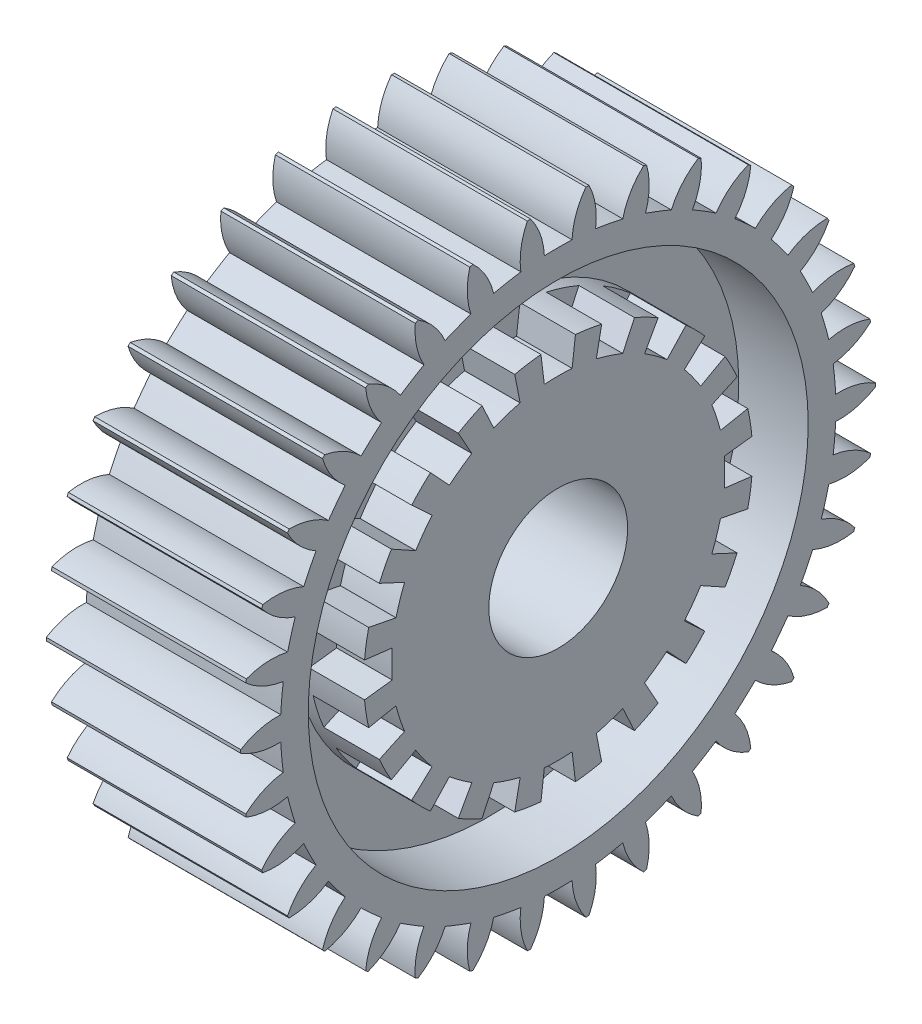
from build123d import *

# Parameters (mm, degrees)
SKETCH1_R                = 114.3
BOSS_EXTRUDE1_DEPTH      = 35
SKETCH2_R                = 25
CUT_EXTRUDE1_DEPTH       = 177.150447062
SKETCH3_R                = 90
SKETCH3_R_2              = 70
CUT_EXTRUDE2_DEPTH       = 25
CUT_EXTRUDE5_DEPTH       = 177.150447062
FILLET2_R                = 150
CIRPATTERN2_START        = -35
CIRPATTERN2_DEPTH        = 70
CUT_EXTRUDE6_DEPTH       = 20
FILLET3_R                = 80
CIRPATTERN3_COUNT        = 20
FILLET3_OF_CIRPATTERN3_R = 80


with BuildPart() as part:
    # Sketch1 → Boss-Extrude1 (new, symmetric)
    with BuildSketch(Plane(origin=(0, 0, 0), x_dir=(0, 0, -1), z_dir=(1, 0, 0))):
        Circle(SKETCH1_R)
    extrude(amount=BOSS_EXTRUDE1_DEPTH, both=True)

    # Sketch2 → Cut-Extrude1 (cut, through all)
    with BuildSketch(Plane(origin=(35, 0, 0), x_dir=(0, 0, -1), z_dir=(1, 0, 0))):
        Circle(SKETCH2_R)
    extrude(amount=-CUT_EXTRUDE1_DEPTH, mode=Mode.SUBTRACT)

    # Sketch3 → Cut-Extrude2 (cut)
    with BuildSketch(Plane(origin=(35, 0, 0), x_dir=(0, 0, -1), z_dir=(1, 0, 0))):
        Circle(SKETCH3_R)
        Circle(SKETCH3_R_2, mode=Mode.SUBTRACT)
    extrude(amount=-CUT_EXTRUDE2_DEPTH, mode=Mode.SUBTRACT)

    # Sketch4 → Cut-Extrude5 (cut, through all)
    with BuildSketch(Plane(origin=(35, 0, 0), x_dir=(0, 0, -1), z_dir=(1, 0, 0))):
        with BuildLine():
            Line((0, 100.093383634), (-4.985, 99.875671587))
            ThreePointArc((-4.985, 99.875671587), (-6.426481355, 107.245609371), (-9.975, 113.863907253))
            Line((-9.975, 113.863907253), (0, 138.618178177))
            Line((0, 138.618178177), (9.975, 113.863907253))
            ThreePointArc((9.975, 113.863907253), (6.426481355, 107.245609371), (4.985, 99.875671587))
            Line((4.985, 99.875671587), (0, 100.093383634))
        make_face()
    extrude(amount=-CUT_EXTRUDE5_DEPTH, mode=Mode.SUBTRACT)

    # Fillet2
    # the kernel refuses this fillet: 150 mm, written as the material it takes off along each edge
    with BuildSketch(Plane(origin=(47.474379628, 100.093383634, 0), x_dir=(0, -0.043631838376275996, -0.9990476778812443), z_dir=(-1, 0, 0))) as fillet2_piece_1:
        with BuildLine():
            CenterArc((6.550659731, 149.991878335), FILLET2_R, 265.594805512, 3.808960835)
            Line((-4.970753497, 0.435009429), (0, 0))
            Line((0, 0), (4.989751851, 0))
        make_face()
    extrude(amount=94.948759255, mode=Mode.SUBTRACT)

    # CirPattern2: read off the stored shape, not the designer's step
    # CirPattern2 outline → CirPattern2 (cut)
    with BuildSketch(Plane.YZ.offset(CIRPATTERN2_START)):
        with BuildLine():
            ThreePointArc((97.259107137, -23.252227398), (104.238686221, -26.023387308), (110.092256415, -30.727594724))
            ThreePointArc((110.092256415, -30.727594724), (112.353825294, -21.002569886), (113.758059295, -11.117281385))
            ThreePointArc((113.758059295, -11.117281385), (106.600411921, -13.389270712), (99.091089829, -13.451985594))
            ThreePointArc((99.091089829, -13.451985594), (98.256544653, -18.367331424), (97.259107137, -23.252227398))
        make_face()
        with BuildLine():
            ThreePointArc((91.330500442, -40.727628079), (97.682039631, -44.734098017), (102.571545825, -50.433798063))
            ThreePointArc((102.571545825, -50.433798063), (106.581575821, -41.289922445), (109.778317065, -31.830977086))
            ThreePointArc((109.778317065, -31.830977086), (102.325065296, -32.749067224), (94.932079854, -31.430879952))
            ThreePointArc((94.932079854, -31.430879952), (93.208551969, -36.109185404), (91.330500442, -40.727628079))
        make_face()
        with BuildLine():
            ThreePointArc((82.291743094, -56.816098234), (87.79894834, -61.921442671), (91.557884263, -68.422538898))
            ThreePointArc((91.557884263, -68.422538898), (97.179818614, -60.171196217), (102.060205912, -51.46070704))
            ThreePointArc((102.060205912, -51.46070704), (94.565161299, -50.99363353), (87.540271758, -48.339433391))
            ThreePointArc((87.540271758, -48.339433391), (84.98645384, -52.621384385), (82.291743094, -56.816098234))
        make_face()
        with BuildLine():
            ThreePointArc((70.450639133, -70.969764307), (74.925969165, -77.000126861), (77.426328764, -84.081232234))
            ThreePointArc((77.426328764, -84.081232234), (84.468719238, -77.003412069), (90.866556855, -69.338004336))
            ThreePointArc((90.866556855, -69.338004336), (83.584954151, -67.501672806), (77.1673847, -63.601845402))
            ThreePointArc((77.1673847, -63.601845402), (73.870243954, -67.341625233), (70.450639133, -70.969764307))
        make_face()
        with BuildLine():
            ThreePointArc((56.210423152, -82.706640175), (59.501475974, -89.456664083), (60.658112502, -96.876640051))
            ThreePointArc((60.658112502, -96.876640051), (68.881138938, -91.213369078), (76.578556186, -84.854079056))
            ThreePointArc((76.578556186, -84.854079056), (69.758361638, -81.711023574), (64.166654908, -76.69837285))
            ThreePointArc((64.166654908, -76.69837285), (60.238471509, -79.7686278), (56.210423152, -82.706640175))
        make_face()
        with BuildLine():
            ThreePointArc((40.056028628, -91.627040608), (42.050731384, -98.8668619), (41.82425697, -106.373030082))
            ThreePointArc((41.82425697, -106.373030082), (50.947894065, -102.317164202), (59.682764633, -97.480549884))
            ThreePointArc((59.682764633, -97.480549884), (53.556231787, -93.137803435), (48.980806643, -87.183029201))
            ThreePointArc((48.980806643, -87.183029201), (44.555350164, -89.47920542), (40.056028628, -91.627040608))
        make_face()
        with BuildLine():
            ThreePointArc((22.537574091, -97.427192067), (23.16799957, -104.910267314), (21.56612653, -112.247014154))
            ThreePointArc((21.56612653, -112.247014154), (31.279679765, -109.936671014), (40.754548111, -106.787437502))
            ThreePointArc((40.754548111, -106.787437502), (35.530308695, -101.392887107), (32.126975753, -94.698772056))
            ThreePointArc((32.126975753, -94.698772056), (27.354949808, -96.142676018), (22.537574091, -97.427192067))
        make_face()
        with BuildLine():
            ThreePointArc((4.251629499, -99.909577352), (3.496309318, -107.3810794), (0.573587516, -114.298560784))
            ThreePointArc((0.573587516, -114.298560784), (10.546273487, -113.81241635), (20.438484333, -112.457807013))
            ThreePointArc((20.438484333, -112.457807013), (16.294443555, -106.195157617), (14.179099236, -98.989661808))
            ThreePointArc((14.179099236, -98.989661808), (9.223009444, -99.532123094), (4.251629499, -99.909577352))
        make_face()
        with BuildLine():
            ThreePointArc((-14.179099236, -98.989661808), (-16.294443555, -106.195157617), (-20.438484333, -112.457807013))
            ThreePointArc((-20.438484333, -112.457807013), (-10.546273487, -113.81241635), (-0.573587516, -114.298560784))
            ThreePointArc((-0.573587516, -114.298560784), (-3.496309318, -107.3810794), (-4.251629499, -99.909577352))
            ThreePointArc((-4.251629499, -99.909577352), (-9.223009444, -99.532123094), (-14.179099236, -98.989661808))
        make_face()
        with BuildLine():
            ThreePointArc((-32.126975753, -94.698772056), (-35.530308695, -101.392887107), (-40.754548111, -106.787437502))
            ThreePointArc((-40.754548111, -106.787437502), (-31.279679765, -109.936671014), (-21.56612653, -112.247014154))
            ThreePointArc((-21.56612653, -112.247014154), (-23.16799957, -104.910267314), (-22.537574091, -97.427192067))
            ThreePointArc((-22.537574091, -97.427192067), (-27.354949808, -96.142676018), (-32.126975753, -94.698772056))
        make_face()
        with BuildLine():
            ThreePointArc((-48.980806643, -87.183029201), (-53.556231787, -93.137803435), (-59.682764633, -97.480549885))
            ThreePointArc((-59.682764633, -97.480549885), (-50.947894065, -102.317164202), (-41.82425697, -106.373030082))
            ThreePointArc((-41.82425697, -106.373030082), (-42.050731384, -98.8668619), (-40.056028628, -91.627040608))
            ThreePointArc((-40.056028628, -91.627040608), (-44.555350164, -89.47920542), (-48.980806643, -87.183029201))
        make_face()
        with BuildLine():
            ThreePointArc((-64.166654908, -76.69837285), (-69.758361638, -81.711023574), (-76.578556186, -84.854079056))
            ThreePointArc((-76.578556186, -84.854079056), (-68.881138938, -91.213369078), (-60.658112502, -96.876640051))
            ThreePointArc((-60.658112502, -96.876640051), (-59.501475974, -89.456664083), (-56.210423152, -82.706640175))
            ThreePointArc((-56.210423152, -82.706640175), (-60.238471509, -79.7686278), (-64.166654908, -76.69837285))
        make_face()
        with BuildLine():
            ThreePointArc((-77.1673847, -63.601845402), (-83.584954151, -67.501672806), (-90.866556855, -69.338004336))
            ThreePointArc((-90.866556855, -69.338004336), (-84.468719238, -77.003412069), (-77.426328764, -84.081232234))
            ThreePointArc((-77.426328764, -84.081232234), (-74.925969165, -77.000126861), (-70.450639133, -70.969764307))
            ThreePointArc((-70.450639133, -70.969764307), (-73.870243954, -67.341625233), (-77.1673847, -63.601845402))
        make_face()
        with BuildLine():
            ThreePointArc((-87.540271758, -48.339433391), (-94.565161299, -50.99363353), (-102.060205913, -51.46070704))
            ThreePointArc((-102.060205913, -51.46070704), (-97.179818614, -60.171196217), (-91.557884263, -68.422538898))
            ThreePointArc((-91.557884263, -68.422538898), (-87.79894834, -61.921442671), (-82.291743094, -56.816098234))
            ThreePointArc((-82.291743094, -56.816098234), (-84.98645384, -52.621384385), (-87.540271758, -48.339433391))
        make_face()
        with BuildLine():
            ThreePointArc((-94.932079854, -31.430879952), (-102.325065296, -32.749067224), (-109.778317065, -31.830977086))
            ThreePointArc((-109.778317065, -31.830977086), (-106.581575821, -41.289922445), (-102.571545825, -50.433798063))
            ThreePointArc((-102.571545825, -50.433798063), (-97.682039631, -44.734098017), (-91.330500442, -40.727628079))
            ThreePointArc((-91.330500442, -40.727628079), (-93.208551969, -36.109185404), (-94.932079854, -31.430879952))
        make_face()
        with BuildLine():
            ThreePointArc((-99.091089829, -13.451985594), (-106.600411921, -13.389270712), (-113.758059295, -11.117281385))
            ThreePointArc((-113.758059295, -11.117281385), (-112.353825294, -21.002569886), (-110.092256415, -30.727594724))
            ThreePointArc((-110.092256415, -30.727594724), (-104.238686221, -26.023387308), (-97.259107137, -23.252227398))
            ThreePointArc((-97.259107137, -23.252227398), (-98.256544653, -18.367331424), (-99.091089829, -13.451985594))
        make_face()
        with BuildLine():
            ThreePointArc((-99.875671587, 4.985), (-107.245609371, 6.426481355), (-113.863907253, 9.975))
            ThreePointArc((-113.863907253, 9.975), (-114.3, 0), (-113.863907253, -9.975))
            ThreePointArc((-113.863907253, -9.975), (-107.245609371, -6.426481355), (-99.875671587, -4.985))
            ThreePointArc((-99.875671587, -4.985), (-99.958528555, 0), (-99.875671587, 4.985))
        make_face()
        with BuildLine():
            ThreePointArc((-97.259107137, 23.252227398), (-104.238686221, 26.023387308), (-110.092256415, 30.727594724))
            ThreePointArc((-110.092256415, 30.727594724), (-112.353825294, 21.002569886), (-113.758059295, 11.117281385))
            ThreePointArc((-113.758059295, 11.117281385), (-106.600411921, 13.389270712), (-99.091089829, 13.451985594))
            ThreePointArc((-99.091089829, 13.451985594), (-98.256544653, 18.367331424), (-97.259107137, 23.252227398))
        make_face()
        with BuildLine():
            ThreePointArc((-91.330500442, 40.727628079), (-97.682039631, 44.734098017), (-102.571545825, 50.433798063))
            ThreePointArc((-102.571545825, 50.433798063), (-106.581575821, 41.289922445), (-109.778317066, 31.830977086))
            ThreePointArc((-109.778317066, 31.830977086), (-102.325065296, 32.749067224), (-94.932079854, 31.430879952))
            ThreePointArc((-94.932079854, 31.430879952), (-93.208551969, 36.109185404), (-91.330500442, 40.727628079))
        make_face()
        with BuildLine():
            ThreePointArc((-82.291743094, 56.816098234), (-87.79894834, 61.921442671), (-91.557884263, 68.422538898))
            ThreePointArc((-91.557884263, 68.422538898), (-97.179818614, 60.171196217), (-102.060205913, 51.46070704))
            ThreePointArc((-102.060205913, 51.46070704), (-94.565161299, 50.99363353), (-87.540271758, 48.339433391))
            ThreePointArc((-87.540271758, 48.339433391), (-84.98645384, 52.621384385), (-82.291743094, 56.816098234))
        make_face()
        with BuildLine():
            ThreePointArc((-70.450639133, 70.969764307), (-74.925969165, 77.000126861), (-77.426328764, 84.081232234))
            ThreePointArc((-77.426328764, 84.081232234), (-84.468719238, 77.003412069), (-90.866556855, 69.338004336))
            ThreePointArc((-90.866556855, 69.338004336), (-83.584954151, 67.501672806), (-77.1673847, 63.601845402))
            ThreePointArc((-77.1673847, 63.601845402), (-73.870243954, 67.341625233), (-70.450639133, 70.969764307))
        make_face()
        with BuildLine():
            ThreePointArc((-56.210423152, 82.706640175), (-59.501475974, 89.456664083), (-60.658112502, 96.876640051))
            ThreePointArc((-60.658112502, 96.876640051), (-68.881138938, 91.213369078), (-76.578556186, 84.854079056))
            ThreePointArc((-76.578556186, 84.854079056), (-69.758361638, 81.711023574), (-64.166654908, 76.69837285))
            ThreePointArc((-64.166654908, 76.69837285), (-60.238471509, 79.7686278), (-56.210423152, 82.706640175))
        make_face()
        with BuildLine():
            ThreePointArc((-40.056028628, 91.627040608), (-42.050731384, 98.8668619), (-41.82425697, 106.373030082))
            ThreePointArc((-41.82425697, 106.373030082), (-50.947894065, 102.317164202), (-59.682764633, 97.480549884))
            ThreePointArc((-59.682764633, 97.480549884), (-53.556231787, 93.137803435), (-48.980806643, 87.183029201))
            ThreePointArc((-48.980806643, 87.183029201), (-44.555350164, 89.47920542), (-40.056028628, 91.627040608))
        make_face()
        with BuildLine():
            ThreePointArc((-22.537574091, 97.427192067), (-23.16799957, 104.910267314), (-21.56612653, 112.247014154))
            ThreePointArc((-21.56612653, 112.247014154), (-31.279679765, 109.936671014), (-40.754548111, 106.787437502))
            ThreePointArc((-40.754548111, 106.787437502), (-35.530308695, 101.392887107), (-32.126975753, 94.698772056))
            ThreePointArc((-32.126975753, 94.698772056), (-27.354949808, 96.142676018), (-22.537574091, 97.427192067))
        make_face()
        with BuildLine():
            ThreePointArc((-4.251629499, 99.909577352), (-3.496309318, 107.3810794), (-0.573587516, 114.298560784))
            ThreePointArc((-0.573587516, 114.298560784), (-10.546273487, 113.81241635), (-20.438484333, 112.457807013))
            ThreePointArc((-20.438484333, 112.457807013), (-16.294443555, 106.195157617), (-14.179099236, 98.989661808))
            ThreePointArc((-14.179099236, 98.989661808), (-9.223009444, 99.532123094), (-4.251629499, 99.909577352))
        make_face()
        with BuildLine():
            ThreePointArc((14.179099236, 98.989661808), (16.294443555, 106.195157617), (20.438484333, 112.457807013))
            ThreePointArc((20.438484333, 112.457807013), (10.546273487, 113.81241635), (0.573587516, 114.298560784))
            ThreePointArc((0.573587516, 114.298560784), (3.496309318, 107.3810794), (4.251629499, 99.909577352))
            ThreePointArc((4.251629499, 99.909577352), (9.223009444, 99.532123094), (14.179099236, 98.989661808))
        make_face()
        with BuildLine():
            ThreePointArc((32.126975753, 94.698772056), (35.530308695, 101.392887107), (40.754548111, 106.787437502))
            ThreePointArc((40.754548111, 106.787437502), (31.279679765, 109.936671014), (21.56612653, 112.247014154))
            ThreePointArc((21.56612653, 112.247014154), (23.16799957, 104.910267314), (22.537574091, 97.427192067))
            ThreePointArc((22.537574091, 97.427192067), (27.354949808, 96.142676018), (32.126975753, 94.698772056))
        make_face()
        with BuildLine():
            ThreePointArc((48.980806643, 87.183029201), (53.556231787, 93.137803435), (59.682764633, 97.480549885))
            ThreePointArc((59.682764633, 97.480549885), (50.947894065, 102.317164202), (41.82425697, 106.373030082))
            ThreePointArc((41.82425697, 106.373030082), (42.050731384, 98.8668619), (40.056028628, 91.627040608))
            ThreePointArc((40.056028628, 91.627040608), (44.555350164, 89.47920542), (48.980806643, 87.183029201))
        make_face()
        with BuildLine():
            ThreePointArc((64.166654908, 76.69837285), (69.758361638, 81.711023574), (76.578556186, 84.854079056))
            ThreePointArc((76.578556186, 84.854079056), (68.881138938, 91.213369078), (60.658112502, 96.876640051))
            ThreePointArc((60.658112502, 96.876640051), (59.501475974, 89.456664083), (56.210423152, 82.706640175))
            ThreePointArc((56.210423152, 82.706640175), (60.238471509, 79.7686278), (64.166654908, 76.69837285))
        make_face()
        with BuildLine():
            ThreePointArc((77.1673847, 63.601845402), (83.584954151, 67.501672806), (90.866556855, 69.338004336))
            ThreePointArc((90.866556855, 69.338004336), (84.468719238, 77.003412069), (77.426328764, 84.081232234))
            ThreePointArc((77.426328764, 84.081232234), (74.925969165, 77.000126861), (70.450639133, 70.969764307))
            ThreePointArc((70.450639133, 70.969764307), (73.870243954, 67.341625233), (77.1673847, 63.601845402))
        make_face()
        with BuildLine():
            ThreePointArc((87.540271758, 48.339433391), (94.565161299, 50.99363353), (102.060205913, 51.46070704))
            ThreePointArc((102.060205913, 51.46070704), (97.179818614, 60.171196217), (91.557884263, 68.422538898))
            ThreePointArc((91.557884263, 68.422538898), (87.79894834, 61.921442671), (82.291743094, 56.816098234))
            ThreePointArc((82.291743094, 56.816098234), (84.98645384, 52.621384385), (87.540271758, 48.339433391))
        make_face()
        with BuildLine():
            ThreePointArc((94.932079854, 31.430879952), (102.325065296, 32.749067224), (109.778317065, 31.830977086))
            ThreePointArc((109.778317065, 31.830977086), (106.581575821, 41.289922445), (102.571545825, 50.433798063))
            ThreePointArc((102.571545825, 50.433798063), (97.682039631, 44.734098017), (91.330500442, 40.727628079))
            ThreePointArc((91.330500442, 40.727628079), (93.208551969, 36.109185404), (94.932079854, 31.430879952))
        make_face()
        with BuildLine():
            ThreePointArc((110.092256415, 30.727594724), (104.238686221, 26.023387308), (97.259107137, 23.252227398))
            ThreePointArc((97.259107137, 23.252227398), (98.256544653, 18.367331424), (99.091089829, 13.451985594))
            ThreePointArc((99.091089829, 13.451985594), (106.600411921, 13.389270712), (113.758059295, 11.117281385))
            ThreePointArc((113.758059295, 11.117281385), (112.353825294, 21.002569886), (110.092256415, 30.727594724))
        make_face()
    extrude(amount=CIRPATTERN2_DEPTH, mode=Mode.SUBTRACT)

    # Sketch5 → Cut-Extrude6 (cut)
    with BuildSketch(Plane(origin=(35, 0, 0), x_dir=(0, 0, -1), z_dir=(1, 0, 0))):
        Polygon((-5, 59.791303716), (-6.818742834, 74.745496099), (6.818742834, 74.745496099), (5, 59.791303716), (0, 60.100050831), align=None)
    cut_extrude6 = extrude(amount=-CUT_EXTRUDE6_DEPTH, mode=Mode.SUBTRACT)

    # Fillet3
    fillet3_edges = [part.edges().sort_by_distance(p)[0] for p in [
        (25, 60.100050831, 0),
    ]]
    fillet(fillet3_edges, radius=FILLET3_R)

    # CirPattern3: Cut-Extrude6 ×20 about axis
    cirpattern3_axis = Axis((0, 0, 0), (1, 0, 0))
    for i in range(1, CIRPATTERN3_COUNT):
        add(cut_extrude6.rotate(cirpattern3_axis, i * 360 / CIRPATTERN3_COUNT), mode=Mode.SUBTRACT)

    # Fillet3 of CirPattern3
    fillet3_of_cirpattern3_edges = [part.edges().sort_by_distance(p)[0] for p in [
        (25, 57.158544972, 18.57193707),
        (25, 48.621962485, 35.32592354),
        (25, 35.32592354, 48.621962485),
        (25, 18.57193707, 57.158544972),
        (25, 0, 60.100050831),
        (25, -18.57193707, 57.158544972),
        (25, -35.32592354, 48.621962485),
        (25, -48.621962485, 35.32592354),
        (25, -57.158544972, 18.57193707),
        (25, -60.100050831, 0),
        (25, -57.158544972, -18.57193707),
        (25, -48.621962485, -35.32592354),
        (25, -35.32592354, -48.621962485),
        (25, -18.57193707, -57.158544972),
        (25, 0, -60.100050831),
        (25, 18.57193707, -57.158544972),
        (25, 35.32592354, -48.621962485),
        (25, 48.621962485, -35.32592354),
        (25, 57.158544972, -18.57193707),
    ]]
    fillet(fillet3_of_cirpattern3_edges, radius=FILLET3_OF_CIRPATTERN3_R)


solid = part.part
